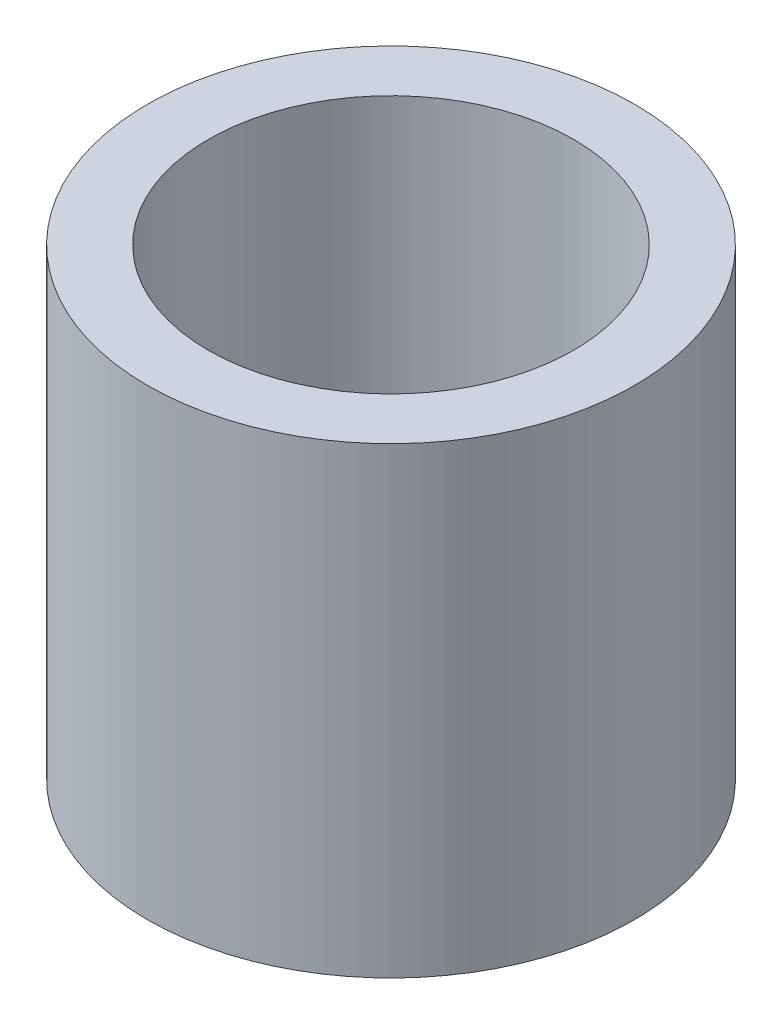
from build123d import *

# Parameters (mm, degrees)
SKETCH1_R           = 6.35
SKETCH1_R_2         = 4.7625
BOSS_EXTRUDE1_DEPTH = 12.065


with BuildPart() as part:
    # Sketch1 → Boss-Extrude1 (new body)
    with BuildSketch(Plane(origin=(0, 0, 0), x_dir=(1, 0, 0), z_dir=(0, 1, 0))):
        Circle(SKETCH1_R)
        Circle(SKETCH1_R_2, mode=Mode.SUBTRACT)
    extrude(amount=BOSS_EXTRUDE1_DEPTH)


solid = part.part
